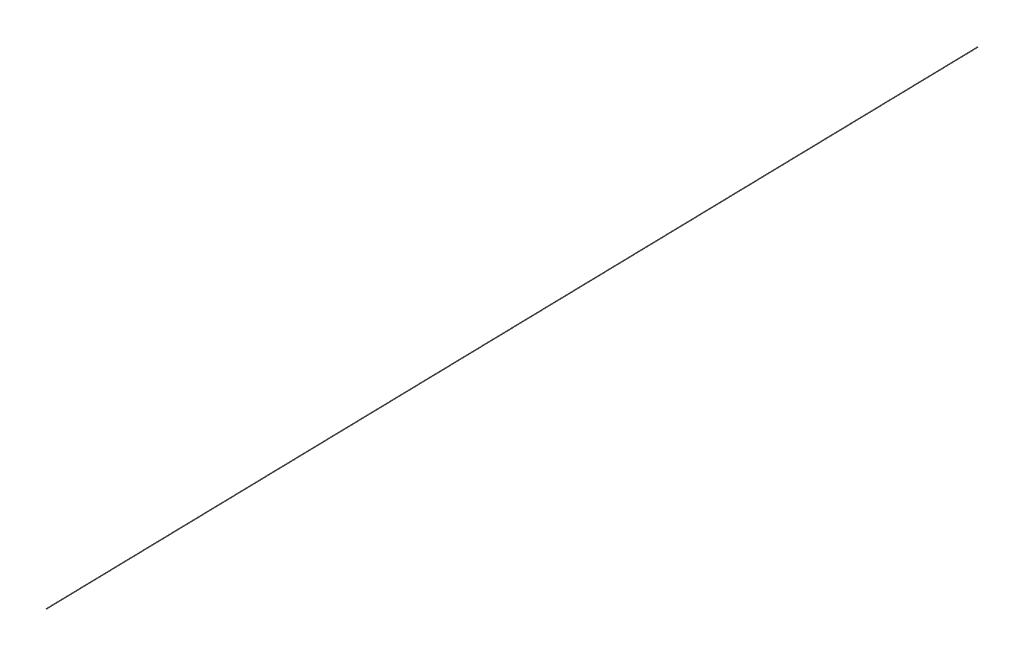
from build123d import *

# Parameters (mm, degrees)
SKETCH2_R = 3.8


with BuildPart() as part:
    # Sweep1: sweep along a path in Sketch1
    with BuildLine(Plane(origin=(0, 0, 0), x_dir=(0, 0, -1), z_dir=(1, 0, 0))) as sweep1_path:
        Line((14563.8, 326.14), (14553.8, 326.14))
        Line((14553.8, 326.14), (10, 0))
        Line((10, 0), (0, 0))
    # Sketch2 → Sweep1 (sweep)
    with BuildSketch(Plane.XY):
        Circle(SKETCH2_R)
    sweep(path=sweep1_path.line, transition=Transition.RIGHT)


solid = part.part
